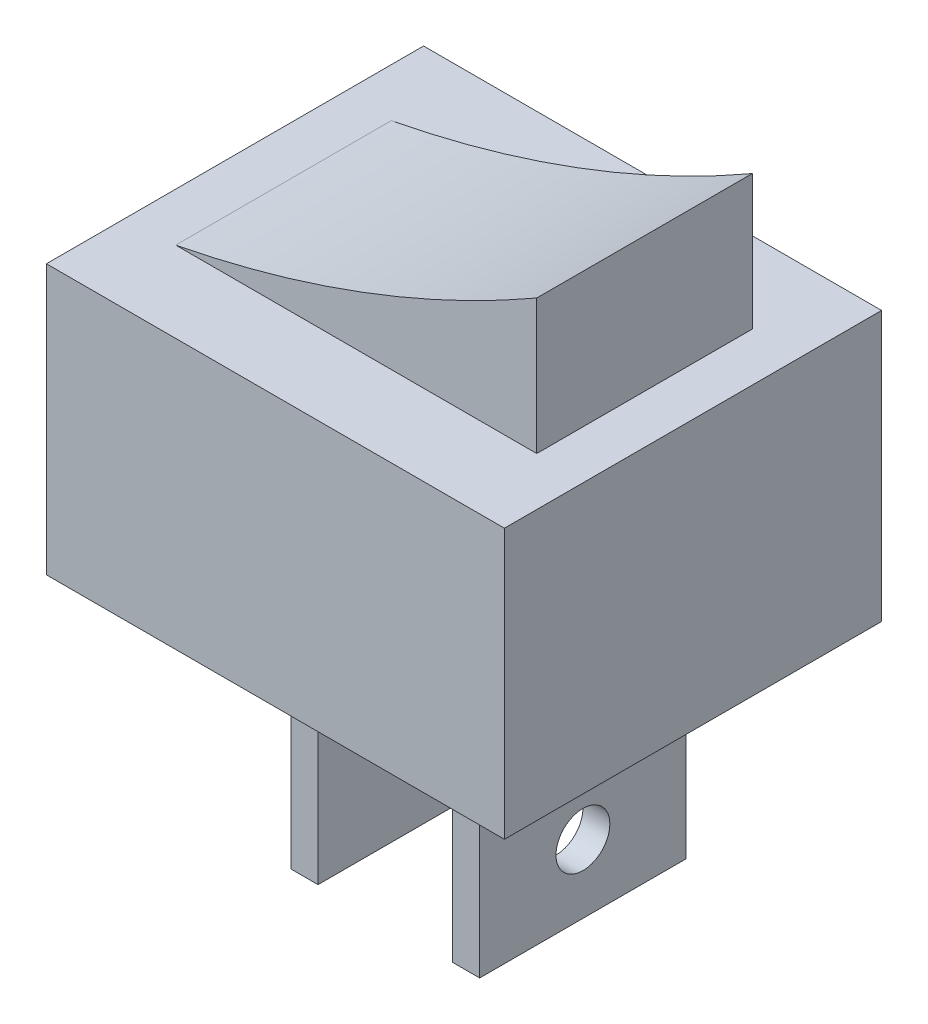
from build123d import *

# Parameters (mm, degrees)
SKETCH1_W           = 17
SKETCH1_H           = 14
BOSS_EXTRUDE1_DEPTH = 10
SKETCH2_W           = 13.4
SKETCH2_H           = 8
BOSS_EXTRUDE2_DEPTH = 5
CUT_EXTRUDE4_START  = -8
CUT_EXTRUDE4_DEPTH  = 8
SKETCH4_W           = 1
SKETCH4_H           = 7.663229465
BOSS_EXTRUDE3_DEPTH = 8
SKETCH5_R           = 1
CUT_EXTRUDE5_DEPTH  = 25.289915603


# Read off the part's stored shape, not the designer's step: Cut-Extrude4
with BuildPart() as part:
    # Sketch1 → Boss-Extrude1 (new body)
    with BuildSketch(Plane(origin=(0, 0, 0), x_dir=(1, 0, 0), z_dir=(0, 1, 0))):
        with Locations((8.5, 7)):
            Rectangle(SKETCH1_W, SKETCH1_H)
    extrude(amount=BOSS_EXTRUDE1_DEPTH)

    # Sketch2 → Boss-Extrude2 (add)
    with BuildSketch(Plane(origin=(0, 10, 0), x_dir=(1, 0, 0), z_dir=(0, 1, 0))):
        with Locations((8.5, 7)):
            Rectangle(SKETCH2_W, SKETCH2_H)
    extrude(amount=BOSS_EXTRUDE2_DEPTH)

    # Cut-Extrude4 outline → Cut-Extrude4 (cut)
    with BuildSketch(Plane.XY.offset(-3).offset(CUT_EXTRUDE4_START)):
        with BuildLine():
            Line((1.8, 15), (1.8, 10))
            ThreePointArc((1.8, 10), (8.708594461, 11.940966845), (15.2, 15))
            Line((15.2, 15), (1.8, 15))
        make_face()
    extrude(amount=CUT_EXTRUDE4_DEPTH, mode=Mode.SUBTRACT)

    # Sketch4 → Boss-Extrude3 (add)
    with BuildSketch(Plane.XZ):
        with Locations((6.5, -6.913355446)):
            Rectangle(SKETCH4_W, SKETCH4_H)
        with Locations((12.5, -6.913355446)):
            Rectangle(SKETCH4_W, SKETCH4_H)
    extrude(amount=BOSS_EXTRUDE3_DEPTH)

    # Sketch5 → Cut-Extrude5 (cut, through all)
    with BuildSketch(Plane(origin=(13, 0, 0), x_dir=(0, 0, -1), z_dir=(1, 0, 0))):
        with Locations((6.913355446, -1.867470442)):
            Circle(SKETCH5_R)
        with Locations((6.913355446, -5.464189838)):
            Circle(SKETCH5_R)
    extrude(amount=-CUT_EXTRUDE5_DEPTH, mode=Mode.SUBTRACT)


solid = part.part
